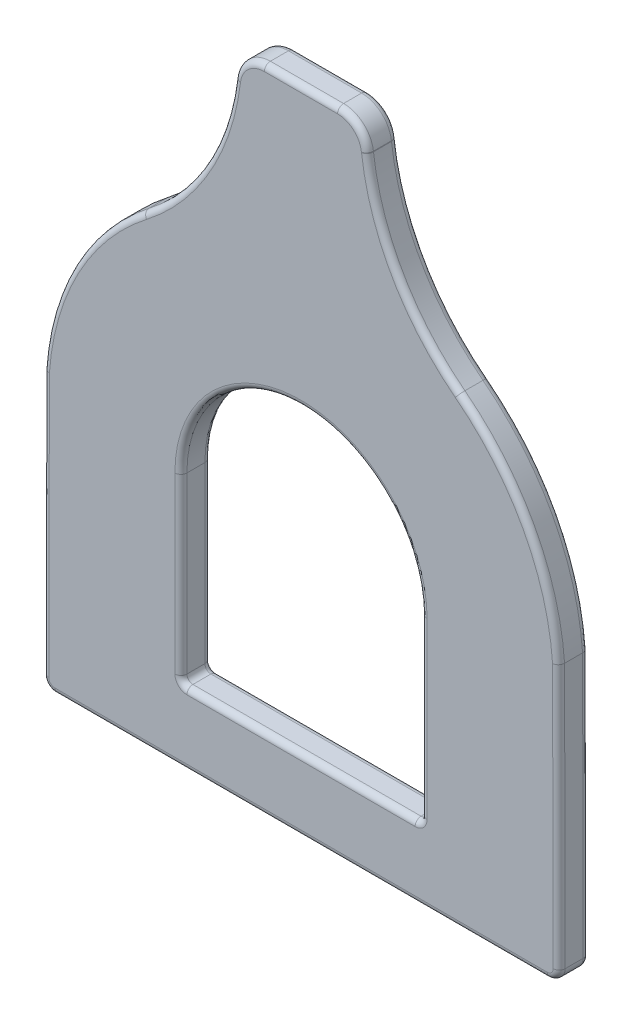
from build123d import *

# Parameters (mm, degrees)
BOSS_EXTRUDE1_DEPTH = 2.5
FILLET1_R           = 1
FILLET2_R           = 0.5
FILLET3_R           = 0.5
CUT_EXTRUDE2_DEPTH  = 2.5
FILLET4_R           = 0.5


with BuildPart() as part:
    # Sketch2 → Boss-Extrude1 (new body)
    with BuildSketch(Plane.XY):
        with BuildLine():
            Line((-21.447614762, 11.499940343), (-21.5, -11.5))
            Line((-21.5, -11.5), (21.5, -11.5))
            Line((21.5, -11.5), (21.447614762, 11.499940343))
            ThreePointArc((21.447614762, 11.499940343), (18.95861031, 20.140073724), (13.153764478, 27.006718674))
            ThreePointArc((13.153764478, 27.006718674), (7.998527865, 32.950546095), (5.534835658, 40.422879711))
            Line((5.534835658, 40.422879711), (5.529472751, 40.467171964))
            ThreePointArc((5.529472751, 40.467171964), (4.705721094, 42.037664161), (3.047599151, 42.666666667))
            Line((3.047599151, 42.666666667), (-3.047599151, 42.666666667))
            ThreePointArc((-3.047599151, 42.666666667), (-4.705721094, 42.037664161), (-5.529472751, 40.467171964))
            Line((-5.529472751, 40.467171964), (-5.534835658, 40.422879711))
            ThreePointArc((-5.534835658, 40.422879711), (-7.998527865, 32.950546095), (-13.153764478, 27.006718674))
            ThreePointArc((-13.153764478, 27.006718674), (-18.95861031, 20.140073724), (-21.447614762, 11.499940343))
        make_face()
    extrude(amount=BOSS_EXTRUDE1_DEPTH)

    # Fillet1
    fillet1_edges = [part.edges().sort_by_distance(p)[0] for p in [
        (21.5, -11.5, 1.25),
        (-21.5, -11.5, 1.25),
    ]]
    fillet(fillet1_edges, radius=FILLET1_R)

    # Fillet2
    # the kernel refuses this fillet: 0.5 mm, written as the material it takes off along each edge
    with BuildSketch(Plane(origin=(0, 10, 2.5), x_dir=(-0.6118029989647665, 0.7910101708939764, 0), z_dir=(0.7910101708939764, 0.6118029989647665, 0))) as fillet2_piece_1:
        with BuildLine():
            CenterArc((21.5 - FILLET2_R, -FILLET2_R), FILLET2_R, 0, 90)
            Line((21.5 - FILLET2_R, 0), (21.5, 0))
            Line((21.5, 0), (21.5, -FILLET2_R))
        make_face()
    revolve(axis=Axis((0, 10, 2.5), (0, 0, 1)), revolution_arc=51.611078363, mode=Mode.SUBTRACT)
    with BuildSketch(Plane(origin=(-21.444767738, 12.749937101, 2.5), x_dir=(0, 0, -1), z_dir=(-0.0022776190557038953, -0.9999974062223548, 0))) as fillet2_piece_2:
        with BuildLine():
            CenterArc((FILLET2_R, FILLET2_R), FILLET2_R, 180, 90)
            Line((0, FILLET2_R), (0, 0))
            Line((0, 0), (FILLET2_R, 0))
        make_face()
    extrude(amount=23.247719781, mode=Mode.SUBTRACT)
    with BuildSketch(Plane(origin=(21.497717187, -10.497722381, 2.5), x_dir=(-0.9999974062223547, -0.002277619055703895, 0), z_dir=(-0.0022776190557038953, 0.9999974062223548, 0))) as fillet2_piece_3:
        with BuildLine():
            CenterArc((FILLET2_R, -FILLET2_R), FILLET2_R, 90, 90)
            Line((0, -FILLET2_R), (0, 0))
            Line((0, 0), (FILLET2_R, 0))
        make_face()
    extrude(amount=23.247719781, mode=Mode.SUBTRACT)
    with BuildSketch(Plane(origin=(0, 10, 2.5), x_dir=(0.999931846454531, 0.011674863854978535, 0), z_dir=(0.011674863854978535, -0.999931846454531, 0))) as fillet2_piece_4:
        with BuildLine():
            CenterArc((21.5 - FILLET2_R, -FILLET2_R), FILLET2_R, 0, 90)
            Line((21.5, -FILLET2_R), (21.5, 0))
            Line((21.5, 0), (21.5 - FILLET2_R, 0))
        make_face()
    revolve(axis=Axis((0, 10, 2.5), (0, 0, 1)), revolution_arc=51.611078363, mode=Mode.SUBTRACT)
    with BuildSketch(Plane(origin=(25.389824457, 42.826922092, 2.5), x_dir=(-0.6118029989647666, -0.7910101708939764, 0), z_dir=(0.7910101708939764, -0.6118029989647666, 0))) as fillet2_piece_5:
        with BuildLine():
            CenterArc((20 + FILLET2_R, FILLET2_R), FILLET2_R, 180, 90)
            Line((20, FILLET2_R), (20, 0))
            Line((20, 0), (20 + FILLET2_R, 0))
        make_face()
    revolve(axis=Axis((25.389824457, 42.826922092, 2.5), (0, 0, -1)), revolution_arc=45.3762464, mode=Mode.SUBTRACT)
    with BuildSketch(Plane(origin=(-20.497719781, -11.5, 2.5), x_dir=(0, 1, 0), z_dir=(1, 0, 0))) as fillet2_piece_6:
        with BuildLine():
            CenterArc((FILLET2_R, -FILLET2_R), FILLET2_R, 90, 90)
            Line((0, -FILLET2_R), (0, 0))
            Line((0, 0), (FILLET2_R, 0))
        make_face()
    extrude(amount=40.995439563, mode=Mode.SUBTRACT)
    with BuildSketch(Plane(origin=(5.534835658, 40.422879711, 2.5), x_dir=(-0.9927494399740624, -0.12020211907943115, 0), z_dir=(-0.12020211907943114, 0.9927494399740623, 0)), Plane(origin=(-5.529472751, 40.467171964, 2.5), x_dir=(0.9927494399740623, -0.1202021190794305, 0), z_dir=(-0.12020211907943051, -0.9927494399740624, 0))) as fillet2_piece_7:
        with BuildLine():
            CenterArc((FILLET2_R, -FILLET2_R), FILLET2_R, 90, 90)
            Line((0, -FILLET2_R), (0, 0))
            Line((0, 0), (FILLET2_R, 0))
        make_face()
    extrude(amount=0.044615743, mode=Mode.SUBTRACT)
    with BuildSketch(Plane(origin=(20.497719781, -10.5, 2.5), x_dir=(0, -1, 0), z_dir=(-1, 0, 0))) as fillet2_piece_8:
        with BuildLine():
            CenterArc((1 - FILLET2_R, -FILLET2_R), FILLET2_R, 0, 90)
            Line((1, -FILLET2_R), (1, 0))
            Line((1, 0), (1 - FILLET2_R, 0))
        make_face()
    revolve(axis=Axis((20.497719781, -10.5, 2.5), (0, 0, 1)), revolution_arc=90.130498072, mode=Mode.SUBTRACT)
    with BuildSketch(Plane(origin=(3.047599151, 40.166666667, 2.5), x_dir=(0.9927494399740617, 0.12020211907943634, 0), z_dir=(0.12020211907943634, -0.9927494399740617, 0))) as fillet2_piece_9:
        with BuildLine():
            CenterArc((2.5 - FILLET2_R, -FILLET2_R), FILLET2_R, 0, 90)
            Line((2.5, -FILLET2_R), (2.5, 0))
            Line((2.5, 0), (2.5 - FILLET2_R, 0))
        make_face()
    revolve(axis=Axis((3.047599151, 40.166666667, 2.5), (0, 0, 1)), revolution_arc=83.096232415, mode=Mode.SUBTRACT)
    with BuildSketch(Plane(origin=(-20.497719781, -10.5, 2.5), x_dir=(-0.9999974062223547, 0.002277619055705668, 0), z_dir=(0.002277619055705668, 0.9999974062223547, 0))) as fillet2_piece_10:
        with BuildLine():
            CenterArc((1 - FILLET2_R, -FILLET2_R), FILLET2_R, 0, 90)
            Line((1 - FILLET2_R, 0), (1, 0))
            Line((1, 0), (1, -FILLET2_R))
        make_face()
    revolve(axis=Axis((-20.497719781, -10.5, 2.5), (0, 0, 1)), revolution_arc=90.130498072, mode=Mode.SUBTRACT)
    with BuildSketch(Plane(origin=(3.047599151, 42.666666667, 2.5), x_dir=(0, -1, 0), z_dir=(-1, 0, 0))) as fillet2_piece_11:
        with BuildLine():
            CenterArc((FILLET2_R, -FILLET2_R), FILLET2_R, 90, 90)
            Line((0, -FILLET2_R), (0, 0))
            Line((0, 0), (FILLET2_R, 0))
        make_face()
    extrude(amount=6.095198302, mode=Mode.SUBTRACT)
    with BuildSketch(Plane(origin=(-3.047599151, 40.166666667, 2.5), x_dir=(0, 1, 0), z_dir=(1, 0, 0))) as fillet2_piece_12:
        with BuildLine():
            CenterArc((2.5 - FILLET2_R, -FILLET2_R), FILLET2_R, 0, 90)
            Line((2.5, -FILLET2_R), (2.5, 0))
            Line((2.5, 0), (2.5 - FILLET2_R, 0))
        make_face()
    revolve(axis=Axis((-3.047599151, 40.166666667, 2.5), (0, 0, 1)), revolution_arc=83.096232415, mode=Mode.SUBTRACT)
    with BuildSketch(Plane(origin=(-25.389824457, 42.826922092, 2.5), x_dir=(0.9927494399740615, -0.12020211907943686, 0), z_dir=(0.12020211907943686, 0.9927494399740615, 0))) as fillet2_piece_13:
        with BuildLine():
            CenterArc((20 + FILLET2_R, FILLET2_R), FILLET2_R, 180, 90)
            Line((20, FILLET2_R), (20, 0))
            Line((20, 0), (20 + FILLET2_R, 0))
        make_face()
    revolve(axis=Axis((-25.389824457, 42.826922092, 2.5), (0, 0, -1)), revolution_arc=45.3762464, mode=Mode.SUBTRACT)

    # Fillet3
    # the kernel refuses this fillet: 0.5 mm, written as the material it takes off along each edge
    with BuildSketch(Plane(origin=(-3.047599151, 40.166666667, 0), x_dir=(0, 1, 0), z_dir=(1, 0, 0))) as fillet3_piece_1:
        with BuildLine():
            CenterArc((2.5 - FILLET3_R, FILLET3_R), FILLET3_R, 270, 90)
            Line((2.5, FILLET3_R), (2.5, 0))
            Line((2.5, 0), (2.5 - FILLET3_R, 0))
        make_face()
    revolve(axis=Axis((-3.047599151, 40.166666667, 0), (0, 0, 1)), revolution_arc=83.096232415, mode=Mode.SUBTRACT)
    with BuildSketch(Plane(origin=(3.047599151, 42.666666667, 0), x_dir=(0, -1, 0), z_dir=(-1, 0, 0))) as fillet3_piece_2:
        with BuildLine():
            CenterArc((FILLET3_R, FILLET3_R), FILLET3_R, 180, 90)
            Line((0, FILLET3_R), (0, 0))
            Line((0, 0), (FILLET3_R, 0))
        make_face()
    extrude(amount=6.095198302, mode=Mode.SUBTRACT)
    with BuildSketch(Plane(origin=(3.047599151, 40.166666667, 0), x_dir=(0.9927494399740617, 0.12020211907943634, 0), z_dir=(0.12020211907943634, -0.9927494399740617, 0))) as fillet3_piece_3:
        with BuildLine():
            CenterArc((2.5 - FILLET3_R, FILLET3_R), FILLET3_R, 270, 90)
            Line((2.5, FILLET3_R), (2.5, 0))
            Line((2.5, 0), (2.5 - FILLET3_R, 0))
        make_face()
    revolve(axis=Axis((3.047599151, 40.166666667, 0), (0, 0, 1)), revolution_arc=83.096232415, mode=Mode.SUBTRACT)
    with BuildSketch(Plane(origin=(5.534835658, 40.422879711, 0), x_dir=(-0.9927494399740624, -0.12020211907943115, 0), z_dir=(-0.12020211907943114, 0.9927494399740623, 0)), Plane(origin=(-5.529472751, 40.467171964, 0), x_dir=(0.9927494399740623, -0.1202021190794305, 0), z_dir=(-0.12020211907943051, -0.9927494399740624, 0))) as fillet3_piece_4:
        with BuildLine():
            CenterArc((FILLET3_R, FILLET3_R), FILLET3_R, 180, 90)
            Line((0, FILLET3_R), (0, 0))
            Line((0, 0), (FILLET3_R, 0))
        make_face()
    extrude(amount=0.044615743, mode=Mode.SUBTRACT)
    with BuildSketch(Plane(origin=(25.389824457, 42.826922092, 0), x_dir=(-0.6118029989647666, -0.7910101708939764, 0), z_dir=(0.7910101708939764, -0.6118029989647666, 0))) as fillet3_piece_5:
        with BuildLine():
            CenterArc((20 + FILLET3_R, -FILLET3_R), FILLET3_R, 90, 90)
            Line((20, -FILLET3_R), (20, 0))
            Line((20, 0), (20 + FILLET3_R, 0))
        make_face()
    revolve(axis=Axis((25.389824457, 42.826922092, 0), (0, 0, -1)), revolution_arc=45.3762464, mode=Mode.SUBTRACT)
    with BuildSketch(Plane(origin=(0, 10, 0), x_dir=(0.999931846454531, 0.011674863854978535, 0), z_dir=(0.011674863854978535, -0.999931846454531, 0))) as fillet3_piece_6:
        with BuildLine():
            CenterArc((21.5 - FILLET3_R, FILLET3_R), FILLET3_R, 270, 90)
            Line((21.5, FILLET3_R), (21.5, 0))
            Line((21.5, 0), (21.5 - FILLET3_R, 0))
        make_face()
    revolve(axis=Axis((0, 10, 0), (0, 0, 1)), revolution_arc=51.611078363, mode=Mode.SUBTRACT)
    with BuildSketch(Plane(origin=(21.497717187, -10.497722381, 0), x_dir=(-0.9999974062223547, -0.002277619055703895, 0), z_dir=(-0.0022776190557038953, 0.9999974062223548, 0))) as fillet3_piece_7:
        with BuildLine():
            CenterArc((FILLET3_R, FILLET3_R), FILLET3_R, 180, 90)
            Line((0, FILLET3_R), (0, 0))
            Line((0, 0), (FILLET3_R, 0))
        make_face()
    extrude(amount=23.247719781, mode=Mode.SUBTRACT)
    with BuildSketch(Plane(origin=(-21.444767738, 12.749937101, 0), x_dir=(0, 0, 1), z_dir=(-0.0022776190557038953, -0.9999974062223548, 0))) as fillet3_piece_8:
        with BuildLine():
            CenterArc((FILLET3_R, -FILLET3_R), FILLET3_R, 90, 90)
            Line((0, -FILLET3_R), (0, 0))
            Line((0, 0), (FILLET3_R, 0))
        make_face()
    extrude(amount=23.247719781, mode=Mode.SUBTRACT)
    with BuildSketch(Plane(origin=(0, 10, 0), x_dir=(-0.6118029989647665, 0.7910101708939764, 0), z_dir=(0.7910101708939764, 0.6118029989647665, 0))) as fillet3_piece_9:
        with BuildLine():
            CenterArc((21.5 - FILLET3_R, FILLET3_R), FILLET3_R, 270, 90)
            Line((21.5 - FILLET3_R, 0), (21.5, 0))
            Line((21.5, 0), (21.5, FILLET3_R))
        make_face()
    revolve(axis=Axis((0, 10, 0), (0, 0, 1)), revolution_arc=51.611078363, mode=Mode.SUBTRACT)
    with BuildSketch(Plane(origin=(-25.389824457, 42.826922092, 0), x_dir=(0.9927494399740615, -0.12020211907943686, 0), z_dir=(0.12020211907943686, 0.9927494399740615, 0))) as fillet3_piece_10:
        with BuildLine():
            CenterArc((20 + FILLET3_R, -FILLET3_R), FILLET3_R, 90, 90)
            Line((20, -FILLET3_R), (20, 0))
            Line((20, 0), (20 + FILLET3_R, 0))
        make_face()
    revolve(axis=Axis((-25.389824457, 42.826922092, 0), (0, 0, -1)), revolution_arc=45.3762464, mode=Mode.SUBTRACT)
    with BuildSketch(Plane(origin=(-20.497719781, -11.5, 0), x_dir=(0, 1, 0), z_dir=(1, 0, 0))) as fillet3_piece_11:
        with BuildLine():
            CenterArc((FILLET3_R, FILLET3_R), FILLET3_R, 180, 90)
            Line((0, FILLET3_R), (0, 0))
            Line((0, 0), (FILLET3_R, 0))
        make_face()
    extrude(amount=40.995439563, mode=Mode.SUBTRACT)
    with BuildSketch(Plane(origin=(20.497719781, -10.5, 0), x_dir=(0, -1, 0), z_dir=(-1, 0, 0))) as fillet3_piece_12:
        with BuildLine():
            CenterArc((1 - FILLET3_R, FILLET3_R), FILLET3_R, 270, 90)
            Line((1, FILLET3_R), (1, 0))
            Line((1, 0), (1 - FILLET3_R, 0))
        make_face()
    revolve(axis=Axis((20.497719781, -10.5, 0), (0, 0, 1)), revolution_arc=90.130498072, mode=Mode.SUBTRACT)
    with BuildSketch(Plane(origin=(-20.497719781, -10.5, 0), x_dir=(-0.9999974062223547, 0.002277619055705668, 0), z_dir=(0.002277619055705668, 0.9999974062223547, 0))) as fillet3_piece_13:
        with BuildLine():
            CenterArc((1 - FILLET3_R, FILLET3_R), FILLET3_R, 270, 90)
            Line((1 - FILLET3_R, 0), (1, 0))
            Line((1, 0), (1, FILLET3_R))
        make_face()
    revolve(axis=Axis((-20.497719781, -10.5, 0), (0, 0, 1)), revolution_arc=90.130498072, mode=Mode.SUBTRACT)

    # Sketch4 → Cut-Extrude2 (cut)
    with BuildSketch(Plane(origin=(0, 0, 0), x_dir=(-1, 0, 0), z_dir=(0, 0, -1))):
        with BuildLine():
            Line((-10, -5.5), (10, -5.5))
            Line((10, -5.5), (10, 9.5))
            ThreePointArc((10, 9.5), (0, 19.5), (-10, 9.5))
            Line((-10, 9.5), (-10, -5.5))
        make_face()
    extrude(amount=-CUT_EXTRUDE2_DEPTH, mode=Mode.SUBTRACT)

    # Fillet4
    fillet4_edges = [part.edges().sort_by_distance(p)[0] for p in [
        (0, 19.5, 2.5),
        (-10, 2, 2.5),
        (0, -5.5, 2.5),
        (-10, -5.5, 1.25),
        (10, 2, 2.5),
        (10, -5.5, 1.25),
        (0, 19.5, 0),
        (10, 2, 0),
        (0, -5.5, 0),
        (-10, 2, 0),
    ]]
    fillet(fillet4_edges, radius=FILLET4_R)


solid = part.part
